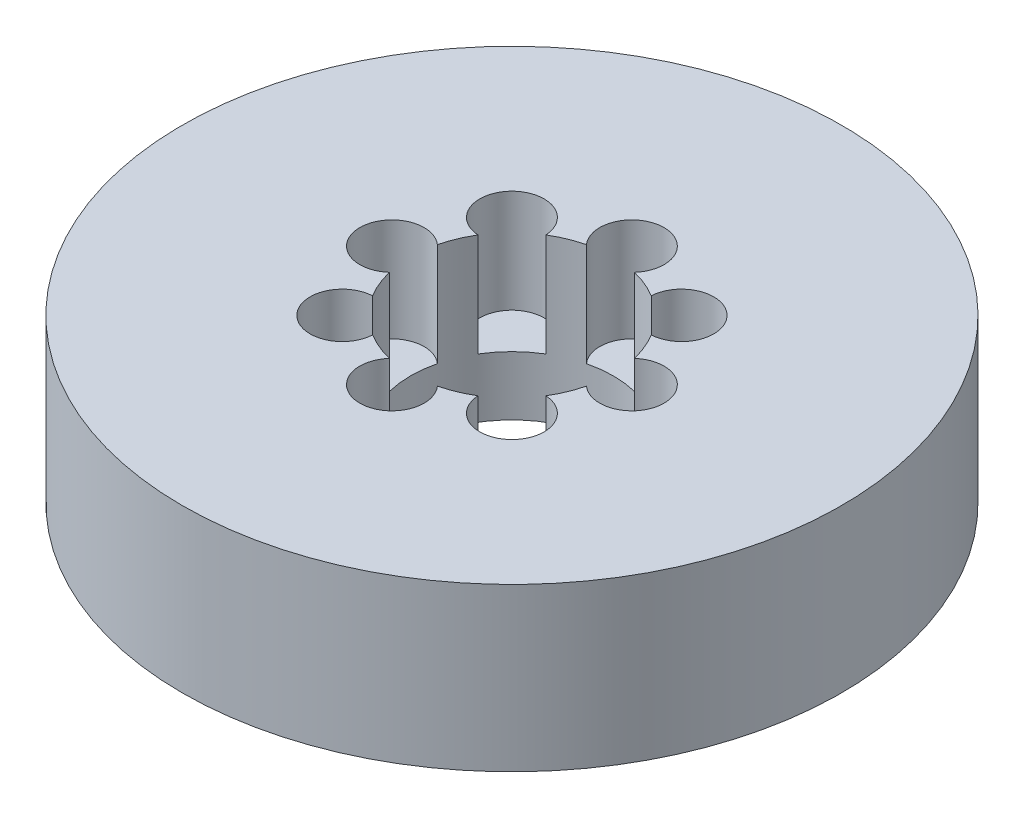
from build123d import *

# Parameters (mm, degrees)
SKETCH1_R           = 32.5
BOSS_EXTRUDE1_DEPTH = 16
SKETCH2_R           = 10
CUT_EXTRUDE1_DEPTH  = 49.66723744
SKETCH3_R           = 3.172235647
CUT_EXTRUDE2_DEPTH  = 10.165660764
CIRPATTERN1_COUNT   = 8


with BuildPart() as part:
    # Sketch1 → Boss-Extrude1 (new body)
    with BuildSketch(Plane(origin=(0, 0, 0), x_dir=(1, 0, 0), z_dir=(0, 1, 0))):
        Circle(SKETCH1_R)
    extrude(amount=BOSS_EXTRUDE1_DEPTH)

    # Sketch2 → Cut-Extrude1 (cut, through all)
    with BuildSketch(Plane(origin=(0, 0, 0), x_dir=(1, 0, 0), z_dir=(0, 1, 0))):
        Circle(SKETCH2_R)
    extrude(amount=CUT_EXTRUDE1_DEPTH, mode=Mode.SUBTRACT)

    # Sketch3 → Cut-Extrude2 (cut)
    with BuildSketch(Plane(origin=(0, 16, 0), x_dir=(1, 0, 0), z_dir=(0, 1, 0))):
        with Locations((-11.828943788, 0)):
            Circle(SKETCH3_R)
    cut_extrude2 = extrude(amount=-CUT_EXTRUDE2_DEPTH, mode=Mode.SUBTRACT)

    # CirPattern1: Cut-Extrude2 ×8 about axis
    cirpattern1_axis = Axis((0, 0, 0), (0, 1, 0))
    for i in range(1, CIRPATTERN1_COUNT):
        add(cut_extrude2.rotate(cirpattern1_axis, i * 360 / CIRPATTERN1_COUNT), mode=Mode.SUBTRACT)


solid = part.part
